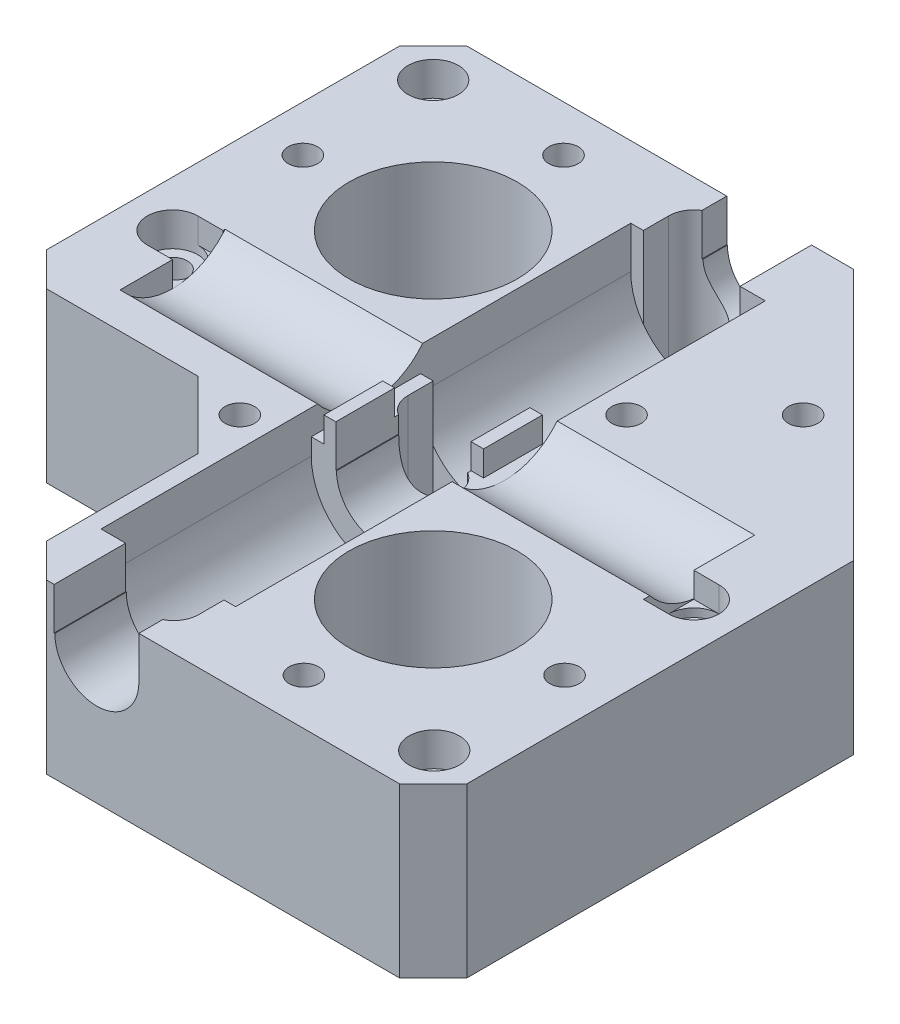
from build123d import *

# Parameters (mm, degrees)
SKETCH2_W                = 80
SKETCH2_H                = 80
BOSS_EXTRUDE1_DEPTH      = 20
CUT_EXTRUDE1_DEPTH       = 61
CUT_EXTRUDE1_DEPTH_BACK  = 61
SKETCH4_R                = 1.75
SKETCH6_R                = 3
SKETCH6_R_2              = 1.75
CUT_EXTRUDE2_DEPTH       = 4
CHAMFER1_SIZE            = 4
SKETCH7_W                = 16
SKETCH7_H                = 25
CUT_EXTRUDE5_DEPTH       = 4
CUT_EXTRUDE6_DEPTH       = 4
CUT_EXTRUDE7_DEPTH       = 13
FILLET1_R                = 8
CUT_EXTRUDE8_DEPTH       = 3
BOSS_EXTRUDE3_DEPTH      = 23.5
CUT_EXTRUDE9_DEPTH       = 65.515502013
CUT_EXTRUDE9_DEPTH_BACK  = 65.515502013
SKETCH13_R               = 4
SKETCH14_R               = 3
SKETCH14_W               = 6
SKETCH14_H               = 3
CUT_EXTRUDE14_DEPTH      = 12
CUT_EXTRUDE15_DEPTH      = 16
SKETCH17_R               = 4
CUT_EXTRUDE16_DEPTH      = 92.651514008
CUT_EXTRUDE17_DEPTH      = 61.000000067
CUT_EXTRUDE17_DEPTH_BACK = 61.000000067
SKETCH18_W               = 30
SKETCH18_H               = 30
CHAMFER2_SIZE            = 4
CHAMFER3_SIZE            = 30
CUT_EXTRUDE20_DEPTH      = 61.0000001
CUT_EXTRUDE20_DEPTH_BACK = 61.0000001
SKETCH21_R               = 10
SKETCH22_R               = 11
SKETCH22_R_2             = 10
CUT_EXTRUDE21_DEPTH      = 3
CHAMFER4_SIZE            = 8
CUT_EXTRUDE22_DEPTH      = 61.0000001
CUT_EXTRUDE22_DEPTH_BACK = 61.0000001
SKETCH23_R               = 1.75
SKETCH25_R               = 1.75
CUT_EXTRUDE23_DEPTH      = 16


with BuildPart() as part:
    # Sketch2 → Boss-Extrude1 (new body)
    with BuildSketch(Plane(origin=(0, 0, 0), x_dir=(1, 0, 0), z_dir=(0, 1, 0))):
        Rectangle(SKETCH2_W, SKETCH2_H)
    extrude(amount=BOSS_EXTRUDE1_DEPTH)

    # Sketch4 → Cut-Extrude1 (cut, two sides: drawn at the far end of the back side and taken through both)
    with BuildSketch(Plane(origin=(0, 20, 0), x_dir=(1, 0, 0), z_dir=(0, 1, 0)).offset(-CUT_EXTRUDE1_DEPTH_BACK)):
        with Locations(Location((-3.5, 3.5, 0), (0, 0, 270))):
            Circle(SKETCH4_R)
        with Locations(Location((3.5, -3.5, 0), (0, 0, 270))):
            Circle(SKETCH4_R)
        with Locations(Location((-3.5, 34.5, 0), (0, 0, 270))):
            Circle(SKETCH4_R)
        with Locations(Location((-34.5, 34.5, 0), (0, 0, 270))):
            Circle(SKETCH4_R)
        with Locations(Location((-34.5, 3.5, 0), (0, 0, 270))):
            Circle(SKETCH4_R)
        with Locations(Location((3.624381161, -34.5, 0), (0, 0, 270))):
            Circle(SKETCH4_R)
        with Locations(Location((34.624381161, -34.5, 0), (0, 0, 270))):
            Circle(SKETCH4_R)
        with Locations(Location((34.5, -3.5, 0), (0, 0, 270))):
            Circle(SKETCH4_R)
    extrude(amount=CUT_EXTRUDE1_DEPTH + CUT_EXTRUDE1_DEPTH_BACK, mode=Mode.SUBTRACT)

    # Sketch6 → Cut-Extrude2 (cut)
    # profile 1 of 9: a face of its own
    with BuildSketch(Plane(origin=(0, 20, 0), x_dir=(1, 0, 0), z_dir=(0, 1, 0))):
        with Locations(Location((-34.5, 34.5, 0), (0, 0, 270))):
            Circle(SKETCH6_R)
        with Locations(Location((-34.5, 34.5, 0), (0, 0, 270))):
            Circle(SKETCH6_R_2, mode=Mode.SUBTRACT)
    # profile 2 of 9: a face of its own
    with BuildSketch(Plane(origin=(0, 20, 0), x_dir=(1, 0, 0), z_dir=(0, 1, 0))):
        with Locations(Location((-34.5, 34.5, 0), (0, 0, 270))):
            Circle(SKETCH6_R_2)
    # profile 3 of 9: a face of its own
    with BuildSketch(Plane(origin=(0, 20, 0), x_dir=(1, 0, 0), z_dir=(0, 1, 0))):
        with Locations(Location((-34.5, 3.5, 0), (0, 0, 270))):
            Circle(SKETCH6_R)
    # profile 4 of 9: a face of its own
    with BuildSketch(Plane(origin=(0, 20, 0), x_dir=(1, 0, 0), z_dir=(0, 1, 0))):
        with Locations(Location((-3.5, 34.5, 0), (0, 0, 270))):
            Circle(SKETCH6_R)
    # profile 5 of 9: a face of its own
    with BuildSketch(Plane(origin=(0, 20, 0), x_dir=(1, 0, 0), z_dir=(0, 1, 0))):
        with Locations(Location((-3.5, 3.5, 0), (0, 0, 270))):
            Circle(SKETCH6_R)
    # profile 6 of 9: a face of its own
    with BuildSketch(Plane(origin=(0, 20, 0), x_dir=(1, 0, 0), z_dir=(0, 1, 0))):
        with Locations(Location((3.5, -3.5, 0), (0, 0, 270))):
            Circle(SKETCH6_R)
    # profile 7 of 9: a face of its own
    with BuildSketch(Plane(origin=(0, 20, 0), x_dir=(1, 0, 0), z_dir=(0, 1, 0))):
        with Locations(Location((34.5, -3.5, 0), (0, 0, 270))):
            Circle(SKETCH6_R)
    # profile 8 of 9: a face of its own
    with BuildSketch(Plane(origin=(0, 20, 0), x_dir=(1, 0, 0), z_dir=(0, 1, 0))):
        with Locations(Location((3.624381161, -34.5, 0), (0, 0, 270))):
            Circle(SKETCH6_R)
    # profile 9 of 9: a face of its own
    with BuildSketch(Plane(origin=(0, 20, 0), x_dir=(1, 0, 0), z_dir=(0, 1, 0))):
        with Locations(Location((34.624381161, -34.5, 0), (0, 0, 270))):
            Circle(SKETCH6_R)
    extrude(amount=-CUT_EXTRUDE2_DEPTH, mode=Mode.SUBTRACT)

    # Chamfer1
    chamfer1_edges = [part.edges().sort_by_distance(p)[0] for p in [
        (40, 10, 40),
        (-40, 10, -40),
    ]]
    chamfer(chamfer1_edges, length=CHAMFER1_SIZE)

    # Sketch7 → Cut-Extrude5 (cut)
    with BuildSketch(Plane(origin=(0, 20, 0), x_dir=(1, 0, 0), z_dir=(0, 1, 0))):
        with BuildLine():
            Line((-6.5, 34.5), (-6.5, 31.5))
            Line((-6.5, 31.5), (-3.5, 31.5))
            ThreePointArc((-3.5, 31.5), (-5.621320344, 32.378679656), (-6.5, 34.5))
        make_face()
        with BuildLine():
            ThreePointArc((-6.5, 34.5), (-5.621320344, 32.378679656), (-3.5, 31.5))
            ThreePointArc((-3.5, 31.5), (-1.378679656, 32.378679656), (-0.5, 34.5))
            Line((-0.5, 34.5), (-6.5, 34.5))
        make_face()
        with BuildLine():
            ThreePointArc((-0.5, 34.5), (-3.5, 37.5), (-6.5, 34.5))
            Line((-6.5, 34.5), (-0.5, 34.5))
        make_face()
        with BuildLine():
            ThreePointArc((-0.5, 34.5), (-1.378679656, 32.378679656), (-3.5, 31.5))
            Line((-3.5, 31.5), (-0.5, 31.5))
            Line((-0.5, 31.5), (-0.5, 34.5))
        make_face()
        with Locations((0, 19)):
            Rectangle(SKETCH7_W, SKETCH7_H)
        with BuildLine():
            Line((-3.5, 6.5), (-6.5, 6.5))
            Line((-6.5, 6.5), (-6.5, 3.5))
            ThreePointArc((-6.5, 3.5), (-5.621320344, 5.621320344), (-3.5, 6.5))
        make_face()
        with BuildLine():
            ThreePointArc((-0.5, 3.5), (-1.378679656, 5.621320344), (-3.5, 6.5))
            ThreePointArc((-3.5, 6.5), (-5.621320344, 5.621320344), (-6.5, 3.5))
            Line((-6.5, 3.5), (-0.5, 3.5))
        make_face()
        with BuildLine():
            Line((-0.5, 3.5), (-6.5, 3.5))
            ThreePointArc((-6.5, 3.5), (-3.5, 0.5), (-0.5, 3.5))
        make_face()
        with BuildLine():
            Line((-0.5, 6.5), (-3.5, 6.5))
            ThreePointArc((-3.5, 6.5), (-1.378679656, 5.621320344), (-0.5, 3.5))
            Line((-0.5, 3.5), (-0.5, 6.5))
        make_face()
    extrude(amount=-CUT_EXTRUDE5_DEPTH, mode=Mode.SUBTRACT)

    # Sketch8 → Cut-Extrude6 (cut)
    with BuildSketch(Plane(origin=(0, 20, 0), x_dir=(1, 0, 0), z_dir=(0, 1, 0))):
        with BuildLine():
            Line((-8, -6.5), (-8, -31.5))
            Line((-8, -31.5), (0.624381161, -31.5))
            Line((0.624381161, -31.5), (0.624381161, -34.5))
            ThreePointArc((0.624381161, -34.5), (3.624381161, -31.5), (6.624381161, -34.5))
            Line((6.624381161, -34.5), (6.624381161, -31.5))
            Line((6.624381161, -31.5), (8, -31.5))
            Line((8, -31.5), (8, -6.5))
            Line((8, -6.5), (6.5, -6.5))
            Line((6.5, -6.5), (6.5, -3.5))
            ThreePointArc((6.5, -3.5), (3.5, -6.5), (0.5, -3.5))
            Line((0.5, -3.5), (0.5, -6.5))
            Line((0.5, -6.5), (-8, -6.5))
        make_face()
    extrude(amount=-CUT_EXTRUDE6_DEPTH, mode=Mode.SUBTRACT)

    # Sketch9 → Cut-Extrude7 (cut)
    with BuildSketch(Plane(origin=(0, 20, 0), x_dir=(1, 0, 0), z_dir=(0, 1, 0))):
        Polygon((-8, 31.5), (-8, 6.5), (-6.5, 6.5), (-0.5, 6.5), (8, 6.5), (8, 31.5), (-0.5, 31.5), (-6.5, 31.5), align=None)
        Polygon((0.624381161, -31.5), (6.624381161, -31.5), (8, -31.5), (8, -6.5), (6.5, -6.5), (0.5, -6.5), (-8, -6.5), (-8, -31.5), align=None)
    extrude(amount=-CUT_EXTRUDE7_DEPTH, mode=Mode.SUBTRACT)

    # Fillet1
    fillet1_edges = [part.edges().sort_by_distance(p)[0] for p in [
        (-8, 7, -19),
        (8, 7, -19),
        (-8, 7, 19),
        (8, 7, 19),
    ]]
    fillet(fillet1_edges, radius=FILLET1_R - 0.0001)  # a hair under: the kernel refuses the full size

    # Sketch10 → Cut-Extrude8 (cut)
    with BuildSketch(Plane(origin=(0, 20, 0), x_dir=(1, 0, 0), z_dir=(0, 1, 0))):
        with BuildLine():
            ThreePointArc((34.5, -0.5), (32.378679656, -1.378679656), (31.5, -3.5))
            ThreePointArc((31.5, -3.5), (32.378679656, -5.621320344), (34.5, -6.5))
            Line((34.5, -6.5), (34.5, -0.5))
        make_face()
        with BuildLine():
            ThreePointArc((37.5, -3.5), (36.621320344, -1.378679656), (34.5, -0.5))
            Line((34.5, -0.5), (34.5, -6.5))
            ThreePointArc((34.5, -6.5), (36.621320344, -5.621320344), (37.5, -3.5))
        make_face()
        with BuildLine():
            Line((34.5, -0.5), (31.5, -0.5))
            Line((31.5, -0.5), (31.5, -3.5))
            ThreePointArc((31.5, -3.5), (32.378679656, -1.378679656), (34.5, -0.5))
        make_face()
        with BuildLine():
            ThreePointArc((34.5, -0.5), (32.378679656, -1.378679656), (31.5, -3.5))
            ThreePointArc((31.5, -3.5), (32.378679656, -5.621320344), (34.5, -6.5))
            Line((34.5, -6.5), (34.5, -0.5))
        make_face()
        with BuildLine():
            ThreePointArc((37.5, -3.5), (36.621320344, -1.378679656), (34.5, -0.5))
            Line((34.5, -0.5), (34.5, -6.5))
            ThreePointArc((34.5, -6.5), (36.621320344, -5.621320344), (37.5, -3.5))
        make_face()
        with BuildLine():
            Line((31.5, -3.5), (31.5, -6.5))
            Line((31.5, -6.5), (34.5, -6.5))
            ThreePointArc((34.5, -6.5), (32.378679656, -5.621320344), (31.5, -3.5))
        make_face()
        Polygon((6.5, 6.5), (6.5, -0.5), (6.5, -3.5), (6.5, -6.5), (8, -6.5), (8, -8), (31.5, -8), (31.5, -6.5), (31.5, -3.5), (31.5, -0.5), (31.5, 8), (8, 8), (8, 6.5), align=None)
        with BuildLine():
            ThreePointArc((6.5, -3.5), (5.621320344, -1.378679656), (3.5, -0.5))
            Line((3.5, -0.5), (3.5, -6.5))
            Line((3.5, -6.5), (6.5, -6.5))
            Line((6.5, -6.5), (6.5, -3.5))
        make_face()
        with BuildLine():
            Line((6.5, -0.5), (3.5, -0.5))
            ThreePointArc((3.5, -0.5), (5.621320344, -1.378679656), (6.5, -3.5))
            Line((6.5, -3.5), (6.5, -0.5))
        make_face()
        Polygon((-31.5, 0.5), (-31.5, -8), (-8, -8), (-8, -6.5), (-6.5, -6.5), (-6.5, 0.5), (-6.5, 3.5), (-6.5, 6.5), (-8, 6.5), (-8, 8), (-31.5, 8), (-31.5, 6.5), (-31.5, 3.5), align=None)
        with BuildLine():
            Line((-6.5, 6.5), (-6.5, 3.5))
            ThreePointArc((-6.5, 3.5), (-5.621320344, 1.378679656), (-3.5, 0.5))
            Line((-3.5, 0.5), (-3.5, 6.5))
            Line((-3.5, 6.5), (-6.5, 6.5))
        make_face()
        with BuildLine():
            Line((-6.5, 3.5), (-6.5, 0.5))
            Line((-6.5, 0.5), (-3.5, 0.5))
            ThreePointArc((-3.5, 0.5), (-5.621320344, 1.378679656), (-6.5, 3.5))
        make_face()
        with BuildLine():
            Line((-34.5, 0.5), (-31.5, 0.5))
            Line((-31.5, 0.5), (-31.5, 3.5))
            ThreePointArc((-31.5, 3.5), (-32.378679656, 1.378679656), (-34.5, 0.5))
        make_face()
        with BuildLine():
            ThreePointArc((-34.5, 0.5), (-32.378679656, 1.378679656), (-31.5, 3.5))
            ThreePointArc((-31.5, 3.5), (-32.378679656, 5.621320344), (-34.5, 6.5))
            Line((-34.5, 6.5), (-34.5, 0.5))
        make_face()
        with BuildLine():
            ThreePointArc((-34.5, 6.5), (-37.5, 3.5), (-34.5, 0.5))
            Line((-34.5, 0.5), (-34.5, 6.5))
        make_face()
        with BuildLine():
            ThreePointArc((-34.5, 6.5), (-32.378679656, 5.621320344), (-31.5, 3.5))
            Line((-31.5, 3.5), (-31.5, 6.5))
            Line((-31.5, 6.5), (-34.5, 6.5))
        make_face()
    extrude(amount=-CUT_EXTRUDE8_DEPTH, mode=Mode.SUBTRACT)

    # Sketch12 → Boss-Extrude3 (add)
    with BuildSketch(Plane(origin=(-31.5, 0, 0), x_dir=(0, 0, -1), z_dir=(1, 0, 0))):
        with BuildLine():
            ThreePointArc((6.5, 19.708497378), (3.791502622, 17.708497378), (0.5, 17))
            Line((0.5, 17), (6.5, 17))
            Line((6.5, 17), (6.5, 19.708497378))
        make_face()
        with BuildLine():
            Line((6.5, 19.708497378), (6.5, 17))
            Line((6.5, 17), (8, 17))
            Line((8, 17), (8, 20))
            Line((8, 20), (6.744997998, 20))
            ThreePointArc((6.744997998, 20), (6.624233621, 19.852790799), (6.5, 19.708497378))
        make_face()
        with BuildLine():
            Line((-8, 17), (0.5, 17))
            ThreePointArc((0.5, 17), (-2.964101615, 17.788897449), (-5.744997998, 20))
            Line((-5.744997998, 20), (-8, 20))
            Line((-8, 20), (-8, 17))
        make_face()
    boss_extrude3 = extrude(amount=BOSS_EXTRUDE3_DEPTH)

    # Mirror1: Boss-Extrude3 across plane
    add(boss_extrude3.mirror(Plane(origin=(0, 0, 0), x_dir=(0, 0, 1), z_dir=(1, 0, 0))))

    # Sketch13 → Cut-Extrude9 (cut, two sides: drawn at the far end of the back side and taken through both)
    with BuildSketch(Plane.XY.offset(6.5).offset(-CUT_EXTRUDE9_DEPTH_BACK)):
        with Locations(Location((0, 15, 0), (0, 0, 14.477512186))):
            Circle(SKETCH13_R)
    extrude(amount=CUT_EXTRUDE9_DEPTH + CUT_EXTRUDE9_DEPTH_BACK, mode=Mode.SUBTRACT)

    # Sketch14 → Cut-Extrude14 (cut)
    with BuildSketch(Plane(origin=(0, 16, 0), x_dir=(1, 0, 0), z_dir=(0, 1, 0))):
        with Locations((3.5, -3.5)):
            Circle(SKETCH14_R)
        with Locations((-3.5, 3.5)):
            Circle(SKETCH14_R)
        with Locations((-3.5, 5)):
            Rectangle(SKETCH14_W, SKETCH14_H)
        with Locations((3.5, -5)):
            Rectangle(SKETCH14_W, SKETCH14_H)
    extrude(amount=-CUT_EXTRUDE14_DEPTH, mode=Mode.SUBTRACT)

    # Sketch16 → Cut-Extrude15 (cut)
    with BuildSketch(Plane(origin=(0, 20, 0), x_dir=(1, 0, 0), z_dir=(0, 1, 0))):
        with BuildLine():
            Line((6.624381161, -34.5), (0.624381161, -34.5))
            ThreePointArc((0.624381161, -34.5), (3.624381161, -37.5), (6.624381161, -34.5))
        make_face()
        with BuildLine():
            ThreePointArc((0.624381161, -34.5), (3.624381161, -37.5), (6.624381161, -34.5))
            Line((6.624381161, -34.5), (0.624381161, -34.5))
        make_face()
        with BuildLine():
            Line((0.624381161, -34.5), (6.624381161, -34.5))
            ThreePointArc((6.624381161, -34.5), (5.745701505, -32.378679656), (3.624381161, -31.5))
            ThreePointArc((3.624381161, -31.5), (1.503060818, -32.378679656), (0.624381161, -34.5))
        make_face()
        with BuildLine():
            ThreePointArc((3.624381161, -31.5), (5.745701505, -32.378679656), (6.624381161, -34.5))
            Line((6.624381161, -34.5), (6.624381161, -31.5))
            Line((6.624381161, -31.5), (3.624381161, -31.5))
        make_face()
        with BuildLine():
            Line((0.624381161, -31.5), (0.624381161, -34.5))
            ThreePointArc((0.624381161, -34.5), (1.503060818, -32.378679656), (3.624381161, -31.5))
            Line((3.624381161, -31.5), (0.624381161, -31.5))
        make_face()
        with BuildLine():
            Line((-0.5, 31.5), (-0.5, 34.5))
            ThreePointArc((-0.5, 34.5), (-1.378679656, 32.378679656), (-3.5, 31.5))
            Line((-3.5, 31.5), (-0.5, 31.5))
        make_face()
        with BuildLine():
            ThreePointArc((-0.5, 34.5), (-3.5, 37.5), (-6.5, 34.5))
            Line((-6.5, 34.5), (-0.5, 34.5))
        make_face()
        with BuildLine():
            Line((-0.5, 34.5), (-6.5, 34.5))
            ThreePointArc((-6.5, 34.5), (-5.621320344, 32.378679656), (-3.5, 31.5))
            ThreePointArc((-3.5, 31.5), (-1.378679656, 32.378679656), (-0.5, 34.5))
        make_face()
        with BuildLine():
            ThreePointArc((-3.5, 31.5), (-5.621320344, 32.378679656), (-6.5, 34.5))
            Line((-6.5, 34.5), (-6.5, 31.5))
            Line((-6.5, 31.5), (-3.5, 31.5))
        make_face()
        with BuildLine():
            Line((-6.5, 34.5), (-0.5, 34.5))
            ThreePointArc((-0.5, 34.5), (-3.5, 37.5), (-6.5, 34.5))
        make_face()
    extrude(amount=-CUT_EXTRUDE15_DEPTH, mode=Mode.SUBTRACT)

    # Sketch17 → Cut-Extrude16 (cut, through all)
    with BuildSketch(Plane.XY.offset(40)):
        with BuildLine():
            Line((5, 20), (-3.1e-08, 20))
            ThreePointArc((-3.1e-08, 20), (3.535533895, 18.535533917), (5, 15))
            Line((5, 15), (5, 20))
        make_face()
        with BuildLine():
            ThreePointArc((5, 15), (3.535533895, 18.535533917), (-3.1e-08, 20))
            ThreePointArc((-3.1e-08, 20), (-3.535533917, 18.535533895), (-5, 15))
            Line((-5, 15), (-4, 15))
            ThreePointArc((-4, 15), (0, 19), (4, 15))
            Line((4, 15), (5, 15))
        make_face()
        with BuildLine():
            ThreePointArc((-5, 15), (0, 10), (5, 15))
            Line((5, 15), (4, 15))
            ThreePointArc((4, 15), (0, 11), (-4, 15))
            Line((-4, 15), (-5, 15))
        make_face()
        with BuildLine():
            ThreePointArc((-4, 15), (0, 11), (4, 15))
            Line((4, 15), (-4, 15))
        make_face()
        with BuildLine():
            Line((-4, 15), (4, 15))
            ThreePointArc((4, 15), (0, 19), (-4, 15))
        make_face()
        with BuildLine():
            ThreePointArc((-4, 15), (0, 11), (4, 15))
            Line((4, 15), (-4, 15))
        make_face()
        with BuildLine():
            Line((-4, 15), (4, 15))
            ThreePointArc((4, 15), (0, 19), (-4, 15))
        make_face()
        with BuildLine():
            Line((-3.1e-08, 20), (-5.082121954, 20))
            Line((-5.082121954, 20), (-5.082121954, 15))
            Line((-5.082121954, 15), (-5, 15))
            ThreePointArc((-5, 15), (-3.535533917, 18.535533895), (-3.1e-08, 20))
        make_face()
        with BuildLine():
            ThreePointArc((5, 15), (3.535533895, 18.535533917), (-3.1e-08, 20))
            ThreePointArc((-3.1e-08, 20), (-3.535533917, 18.535533895), (-5, 15))
            Line((-5, 15), (-4, 15))
            ThreePointArc((-4, 15), (0, 19), (4, 15))
            Line((4, 15), (5, 15))
        make_face()
        with BuildLine():
            ThreePointArc((-5, 15), (0, 10), (5, 15))
            Line((5, 15), (4, 15))
            ThreePointArc((4, 15), (0, 11), (-4, 15))
            Line((-4, 15), (-5, 15))
        make_face()
        with Locations((0, 15)):
            Circle(SKETCH17_R)
    extrude(amount=-CUT_EXTRUDE16_DEPTH, mode=Mode.SUBTRACT)

    # Sketch18 → Cut-Extrude17 (cut, two sides: drawn at the far end of the back side and taken through both)
    with BuildSketch(Plane(origin=(0, 20, 0), x_dir=(1, 0, 0), z_dir=(0, 1, 0)).offset(-CUT_EXTRUDE17_DEPTH_BACK)):
        with Locations((-25, -25)):
            Rectangle(SKETCH18_W, SKETCH18_H)
    extrude(amount=CUT_EXTRUDE17_DEPTH + CUT_EXTRUDE17_DEPTH_BACK, mode=Mode.SUBTRACT)

    # Chamfer2
    chamfer2_edges = [part.edges().sort_by_distance(p)[0] for p in [
        (-10, 10, 40),
        (-40, 10, 10),
    ]]
    chamfer(chamfer2_edges, length=CHAMFER2_SIZE)

    # Chamfer3
    chamfer3_edges = [part.edges().sort_by_distance(p)[0] for p in [
        (40, 10, -40),
    ]]
    chamfer(chamfer3_edges, length=CHAMFER3_SIZE)

    # Sketch21 → Cut-Extrude20 (cut, two sides: drawn at the far end of the back side and taken through both)
    with BuildSketch(Plane.XZ.offset(-CUT_EXTRUDE20_DEPTH_BACK)):
        with Locations(Location((-19, -19, 0), (0, 0, 270))):
            Circle(SKETCH21_R)
        with Locations(Location((19, 19, 0), (0, 0, 270))):
            Circle(SKETCH21_R)
    extrude(amount=CUT_EXTRUDE20_DEPTH + CUT_EXTRUDE20_DEPTH_BACK, mode=Mode.SUBTRACT)

    # Sketch22 → Cut-Extrude21 (cut)
    # profile 1 of 2: a face of its own
    with BuildSketch(Plane.XZ):
        with Locations(Location((-19, -19, 0), (0, 0, 270))):
            Circle(SKETCH22_R)
        with Locations(Location((-19, -19, 0), (0, 0, 270))):
            Circle(SKETCH22_R_2, mode=Mode.SUBTRACT)
    # profile 2 of 2: a face of its own
    with BuildSketch(Plane.XZ):
        with Locations(Location((19, 19, 0), (0, 0, 270))):
            Circle(SKETCH22_R)
        with Locations(Location((19, 19, 0), (0, 0, 270))):
            Circle(SKETCH22_R_2, mode=Mode.SUBTRACT)
    extrude(amount=-CUT_EXTRUDE21_DEPTH, mode=Mode.SUBTRACT)

    # Chamfer4
    chamfer4_edges = [part.edges().sort_by_distance(p)[0] for p in [
        (-10, 10, 10),
    ]]
    chamfer(chamfer4_edges, length=CHAMFER4_SIZE)

    # Sketch23 → Cut-Extrude22 (cut, two sides: drawn at the far end of the back side and taken through both)
    with BuildSketch(Plane.XZ.offset(-CUT_EXTRUDE22_DEPTH_BACK)):
        with Locations(Location((-34.5, -19, 0), (0, 0, 270))):
            Circle(SKETCH23_R)
        with Locations(Location((-19, -34.5, 0), (0, 0, 270))):
            Circle(SKETCH23_R)
        with Locations(Location((-11.5, 11.5, 0), (0, 0, 270))):
            Circle(SKETCH23_R)
        with Locations(Location((11.5, -11.5, 0), (0, 0, 270))):
            Circle(SKETCH23_R)
        with Locations(Location((19.124381161, 34.5, 0), (0, 0, 270))):
            Circle(SKETCH23_R)
        with Locations(Location((34.624381161, 19, 0), (0, 0, 270))):
            Circle(SKETCH23_R)
        with Locations(Location((22, -22, 0), (0, 0, 270))):
            Circle(SKETCH23_R)
    extrude(amount=CUT_EXTRUDE22_DEPTH + CUT_EXTRUDE22_DEPTH_BACK, mode=Mode.SUBTRACT)

    # Sketch25 → Cut-Extrude23 (cut)
    # profile 1 of 7: a face of its own
    with BuildSketch(Plane.XZ):
        Polygon((11.5, -8.324573519), (8.75, -9.91228676), (8.75, -13.08771324), (11.5, -14.675426481), (14.25, -13.08771324), (14.25, -9.91228676), align=None)
        with Locations(Location((11.5, -11.5, 0), (0, 0, 270))):
            Circle(SKETCH25_R, mode=Mode.SUBTRACT)
    # profile 2 of 7: a face of its own
    with BuildSketch(Plane.XZ):
        Polygon((-11.5, 14.675426481), (-14.25, 13.08771324), (-14.25, 9.91228676), (-11.5, 8.324573519), (-8.75, 9.91228676), (-8.75, 13.08771324), align=None)
        with Locations(Location((-11.5, 11.5, 0), (0, 0, 270))):
            Circle(SKETCH25_R, mode=Mode.SUBTRACT)
    # profile 3 of 7: a face of its own
    with BuildSketch(Plane.XZ):
        Polygon((-34.5, -15.824573519), (-37.25, -17.41228676), (-37.25, -20.58771324), (-34.5, -22.175426481), (-31.75, -20.58771324), (-31.75, -17.41228676), align=None)
        with Locations(Location((-34.5, -19, 0), (0, 0, 270))):
            Circle(SKETCH25_R, mode=Mode.SUBTRACT)
    # profile 4 of 7: a face of its own
    with BuildSketch(Plane.XZ):
        Polygon((-22.175426481, -34.5), (-20.58771324, -37.25), (-17.41228676, -37.25), (-15.824573519, -34.5), (-17.41228676, -31.75), (-20.58771324, -31.75), align=None)
        with Locations(Location((-19, -34.5, 0), (0, 0, 270))):
            Circle(SKETCH25_R, mode=Mode.SUBTRACT)
    # profile 5 of 7: a face of its own
    with BuildSketch(Plane.XZ):
        Polygon((25.175426481, -22), (23.58771324, -19.25), (20.41228676, -19.25), (18.824573519, -22), (20.41228676, -24.75), (23.58771324, -24.75), align=None)
        with Locations(Location((22, -22, 0), (0, 0, 270))):
            Circle(SKETCH25_R, mode=Mode.SUBTRACT)
    # profile 6 of 7: a face of its own
    with BuildSketch(Plane.XZ):
        Polygon((34.624381161, 22.175426481), (31.874381161, 20.58771324), (31.874381161, 17.41228676), (34.624381161, 15.824573519), (37.374381161, 17.41228676), (37.374381161, 20.58771324), align=None)
        with Locations(Location((34.624381161, 19, 0), (0, 0, 270))):
            Circle(SKETCH25_R, mode=Mode.SUBTRACT)
    # profile 7 of 7: a face of its own
    with BuildSketch(Plane.XZ):
        Polygon((22.299807642, 34.5), (20.712094401, 37.25), (17.536667921, 37.25), (15.948954681, 34.5), (17.536667921, 31.75), (20.712094401, 31.75), align=None)
        with Locations(Location((19.124381161, 34.5, 0), (0, 0, 270))):
            Circle(SKETCH25_R, mode=Mode.SUBTRACT)
    extrude(amount=-CUT_EXTRUDE23_DEPTH, mode=Mode.SUBTRACT)


solid = part.part
